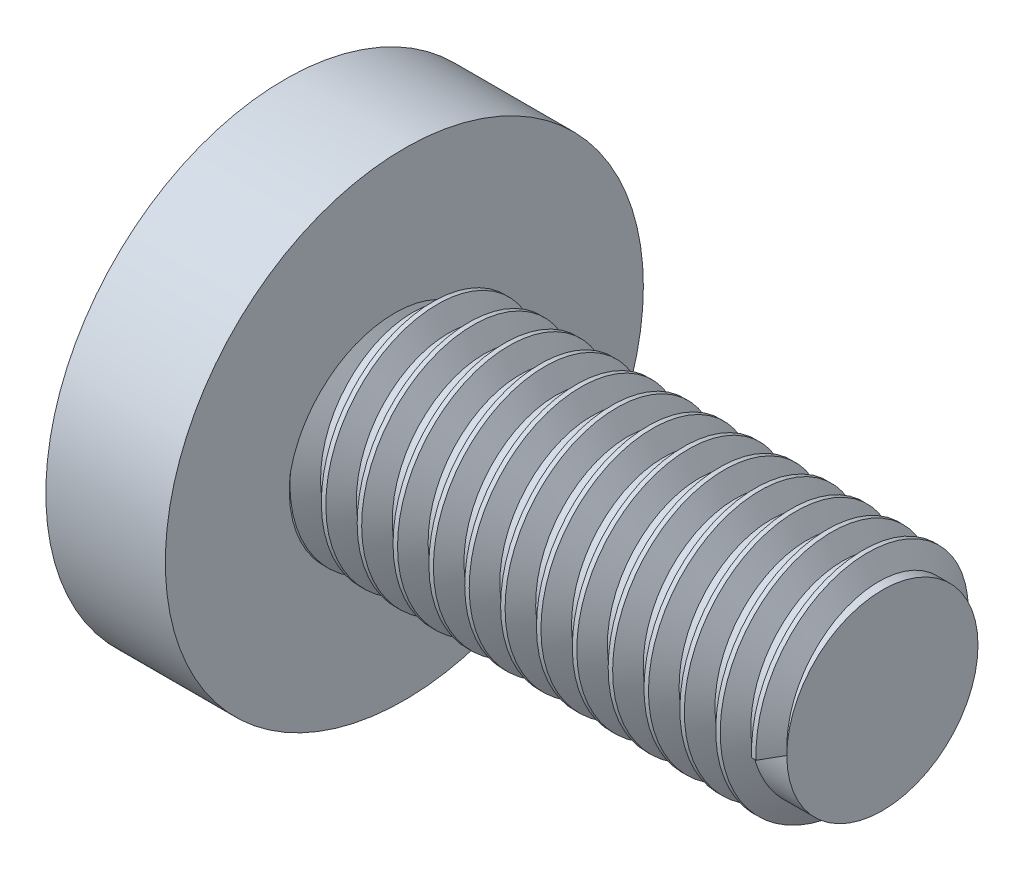
from build123d import *
from build123d.topology import SkipClean

# Parameters (mm, degrees)
DI_1_PITCH = 1.5


with BuildPart() as part:
    # Sketch4 → Revolve1 (revolve)
    with BuildSketch(Plane.XY, mode=Mode.PRIVATE) as revolve1_sk:
        Polygon((0, 0), (0, 10), (5, 10), (5, 4), (25, 4), (25, 0), align=None)
    revolve(revolve1_sk.sketch.rotate(Axis((25, 0, 0), (-1, 0, 0)), 90), axis=Axis((25, 0, 0), (-1, 0, 0)))

    # Diş1: the profile of Diş Profili2 profile screwed along a right-hand helix of 13.333333 turns, 8 arcs to a turn; built about Z, then put on its axis
    with SkipClean():  # the faces are left unmerged after this step: merging them gives an invalid solid
        di_1_z = Axis((0, 0, 0), (0, 0, 1))
        di_1_corners = [(3.9997, 0, -0.000173205), (4.811898813, 0, 0.468749998), (4.811898813, 0, 0.656249998), (3.9997, 0, 1.125173201)]
        with BuildLine(mode=Mode.PRIVATE) as di_1_profile:
            Line(di_1_corners[0], di_1_corners[1])
            Line(di_1_corners[1], di_1_corners[2])
            Line(di_1_corners[2], di_1_corners[3])
            Line(di_1_corners[3], di_1_corners[0])
        di_1_cap = Face(di_1_profile.wire())
        di_1_turn_angles = [0, 22.5, 45, 67.5, 90, 112.5, 135, 157.5, 180, 202.5, 225, 247.5, 270, 292.5, 315, 337.5, 360]
        di_1_turn_weights = [1, 0.9238795325112867, 1, 0.9238795325112867, 1, 0.9238795325112867, 1, 0.9238795325112867, 1, 0.9238795325112867, 1, 0.9238795325112867, 1, 0.9238795325112867, 1, 0.9238795325112867, 1]
        di_1_turn_rails = [Edge.make_bspline([Vector(p[0], p[1], 0).rotate(di_1_z, di_1_turn_angles[k]) / di_1_turn_weights[k] + Vector(0, 0, p[2] + DI_1_PITCH * di_1_turn_angles[k] / 360) for k in range(17)], [0, 0, 0, 1, 1, 2, 2, 3, 3, 4, 4, 5, 5, 6, 6, 7, 7, 8, 8, 8], 2, di_1_turn_weights) for p in di_1_corners]
        di_1_turn_sides = [Face.make_surface_from_curves(di_1_turn_rails[p[0]], di_1_turn_rails[p[1]]) for p in [(0, 1), (1, 2), (2, 3), (3, 0)]]
        di_1_last_angles = [4680, 4702.5, 4725, 4747.5, 4770, 4785, 4800]
        di_1_last_weights = [1, 0.9238795325112867, 1, 0.9238795325112867, 1, 0.9659258262890703, 1]
        di_1_last_rails = [Edge.make_bspline([Vector(p[0], p[1], 0).rotate(di_1_z, di_1_last_angles[k]) / di_1_last_weights[k] + Vector(0, 0, p[2] + DI_1_PITCH * di_1_last_angles[k] / 360) for k in range(7)], [0, 0, 0, 1, 1, 2, 2, 3, 3, 3], 2, di_1_last_weights) for p in di_1_corners]
        di_1_last_sides = [Face.make_surface_from_curves(di_1_last_rails[p[0]], di_1_last_rails[p[1]]) for p in [(0, 1), (1, 2), (2, 3), (3, 0)]]
        di_1 = Plane(origin=(25, 0, 0), x_dir=(0, 0, 1), z_dir=(-1, 0, 0)) * Solid(Shell([*[p.moved(Location((0, 0, DI_1_PITCH * i))) for i in range(13) for p in di_1_turn_sides], *di_1_last_sides, di_1_cap, di_1_cap.rotate(di_1_z, 4800).moved(Location((0, 0, DI_1_PITCH * 4800 / 360)))]))
        add(di_1)


solid = part.part
